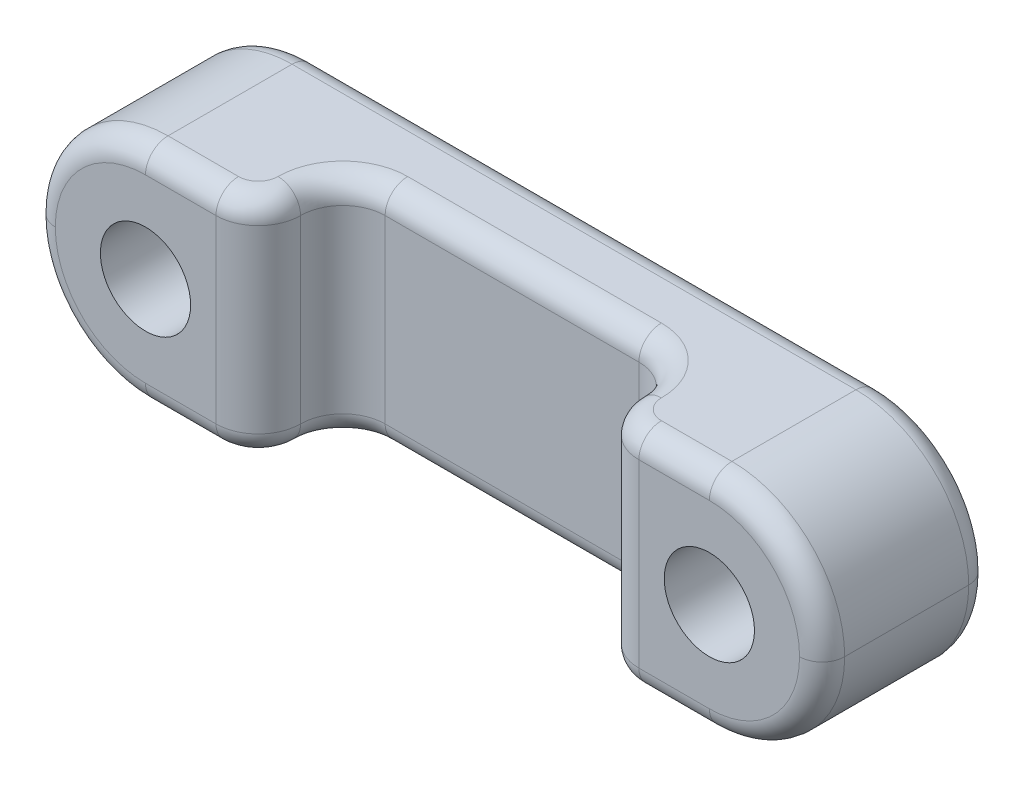
from build123d import *

# Parameters (mm, degrees)
SKETCH1_W           = 28
SKETCH1_H           = 8
SKETCH1_R           = 1.6
BOSS_EXTRUDE1_DEPTH = 3
SKETCH2_W           = 8
SKETCH2_H           = 8
SKETCH2_R           = 1.6
BOSS_EXTRUDE2_DEPTH = 3
FILLET1_R           = 4
FILLET2_START       = -1
FILLET2_DEPTH       = 10
FILLET2_2_DEPTH     = 8
FILLET3_R           = 0.8


with BuildPart() as part:
    # Sketch1 → Boss-Extrude1 (new body)
    with BuildSketch(Plane.XY):
        with Locations((14, 4)):
            Rectangle(SKETCH1_W, SKETCH1_H)
        with Locations((4, 4)):
            Circle(SKETCH1_R, mode=Mode.SUBTRACT)
        with Locations((24, 4)):
            Circle(SKETCH1_R, mode=Mode.SUBTRACT)
    extrude(amount=BOSS_EXTRUDE1_DEPTH)

    # Sketch2 → Boss-Extrude2 (add)
    # profile 1 of 2: a face of its own
    with BuildSketch(Plane.XY.offset(3)):
        with Locations((4, 4)):
            Rectangle(SKETCH2_W, SKETCH2_H)
        with Locations((4, 4)):
            Circle(SKETCH2_R, mode=Mode.SUBTRACT)
    # profile 2 of 2: a face of its own
    with BuildSketch(Plane.XY.offset(3)):
        with Locations((24, 4)):
            Rectangle(SKETCH2_W, SKETCH2_H)
        with Locations((24, 4)):
            Circle(SKETCH2_R, mode=Mode.SUBTRACT)
    extrude(amount=BOSS_EXTRUDE2_DEPTH)

    # Fillet1
    fillet1_edges = [part.edges().sort_by_distance(p)[0] for p in [
        (28, 8, 3),
        (28, 0, 3),
        (0, 8, 3),
        (0, 0, 3),
    ]]
    fillet(fillet1_edges, radius=FILLET1_R - 0.0001)  # a hair under: the kernel refuses the full size

    # Fillet2: read off the stored shape, not the designer's step
    # Fillet2 outline → Fillet2 (cut)
    with BuildSketch(Plane(origin=(0, 0, 0), x_dir=(1, 0, 0), z_dir=(0, 1, 0)).offset(FILLET2_START)):
        with BuildLine():
            Line((8, -6), (8, -4.5))
            ThreePointArc((8, -4.5), (7.560660172, -5.560660172), (6.5, -6))
            Line((6.5, -6), (8, -6))
        make_face()
        with BuildLine():
            ThreePointArc((21.5, -6), (20.439339828, -5.560660172), (20, -4.5))
            Line((20, -4.5), (20, -6))
            Line((20, -6), (21.5, -6))
        make_face()
    extrude(amount=FILLET2_DEPTH, mode=Mode.SUBTRACT)

    # Fillet2 2 outline → Fillet2 2 (add)
    with BuildSketch(Plane(origin=(0, 0, 0), x_dir=(1, 0, 0), z_dir=(0, 1, 0))):
        with BuildLine():
            Line((8, -3), (8, -4.5))
            ThreePointArc((8, -4.5), (8.439339828, -3.439339828), (9.5, -3))
            Line((9.5, -3), (8, -3))
        make_face()
        with BuildLine():
            Line((20, -3), (18.5, -3))
            ThreePointArc((18.5, -3), (19.560660172, -3.439339828), (20, -4.5))
            Line((20, -4.5), (20, -3))
        make_face()
    extrude(amount=FILLET2_2_DEPTH)

    # Fillet3
    fillet3_edges = [part.edges().sort_by_distance(p)[0] for p in [
        (14, 8, 0),
        (22.75005, 8, 6),
        (14, 0, 0),
        (1.171543586, 1.171543586, 0),
        (1.171543586, 6.828456414, 0),
        (26.828456414, 1.171543586, 0),
        (26.828456414, 6.828456414, 0),
        (26.828456414, 1.171543586, 6),
        (26.828456414, 6.828456414, 6),
        (5.24995, 0, 6),
        (1.171543586, 1.171543586, 6),
        (1.171543586, 6.828456414, 6),
        (5.24995, 8, 6),
        (14, 8, 3),
        (20.439339828, 8, 5.560660172),
        (7.560660172, 8, 5.560660172),
        (22.75005, 0, 6),
        (14, 0, 3),
        (20.439339828, 0, 5.560660172),
        (7.560660172, 0, 5.560660172),
        (19.560660172, 0, 3.439339828),
        (19.560660172, 8, 3.439339828),
        (8.439339828, 8, 3.439339828),
        (8.439339828, 0, 3.439339828),
    ]]
    fillet(fillet3_edges, radius=FILLET3_R)


solid = part.part
